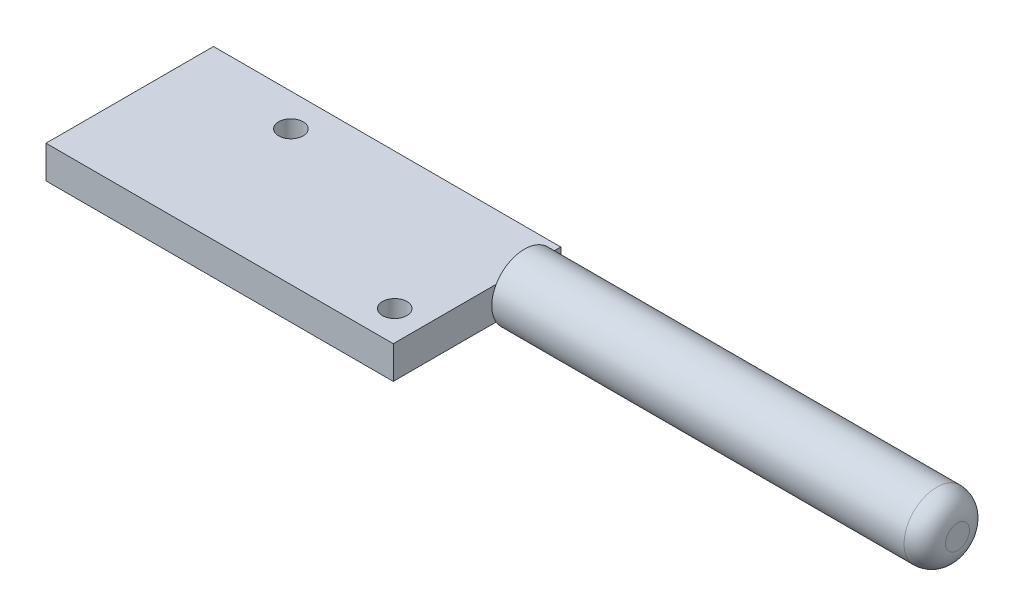
from build123d import *

# Parameters (mm, degrees)
SKETCH1_W           = 42.5
SKETCH1_H           = 20.5
BOSS_EXTRUDE1_DEPTH = 4
SKETCH2_R           = 4
BOSS_EXTRUDE2_DEPTH = 53
FILLET1_R           = 2.54
SKETCH4_R           = 1.5
CUT_EXTRUDE2_DEPTH  = 76.193915985


with BuildPart() as part:
    # Sketch1 → Boss-Extrude1 (new body)
    with BuildSketch(Plane(origin=(0, 0, 0), x_dir=(1, 0, 0), z_dir=(0, 1, 0))):
        Rectangle(SKETCH1_W, SKETCH1_H)
    extrude(amount=BOSS_EXTRUDE1_DEPTH)

    # Sketch2 → Boss-Extrude2 (add)
    with BuildSketch(Plane(origin=(21.25, 0, 0), x_dir=(0, 0, -1), z_dir=(1, 0, 0))):
        with Locations((5.804410425, 2)):
            Circle(SKETCH2_R)
    extrude(amount=BOSS_EXTRUDE2_DEPTH)

    # Fillet1
    fillet1_edges = [part.edges().sort_by_distance(p)[0] for p in [
        (74.25, 2, -1.804410425),
    ]]
    fillet(fillet1_edges, radius=FILLET1_R)

    # Sketch4 → Cut-Extrude2 (cut, through all)
    with BuildSketch(Plane(origin=(0, 4, 0), x_dir=(1, 0, 0), z_dir=(0, 1, 0))):
        with Locations((17.612, -6.44)):
            Circle(SKETCH4_R)
        with Locations((-7.788, 6.26)):
            Circle(SKETCH4_R)
    extrude(amount=-CUT_EXTRUDE2_DEPTH, mode=Mode.SUBTRACT)


solid = part.part
